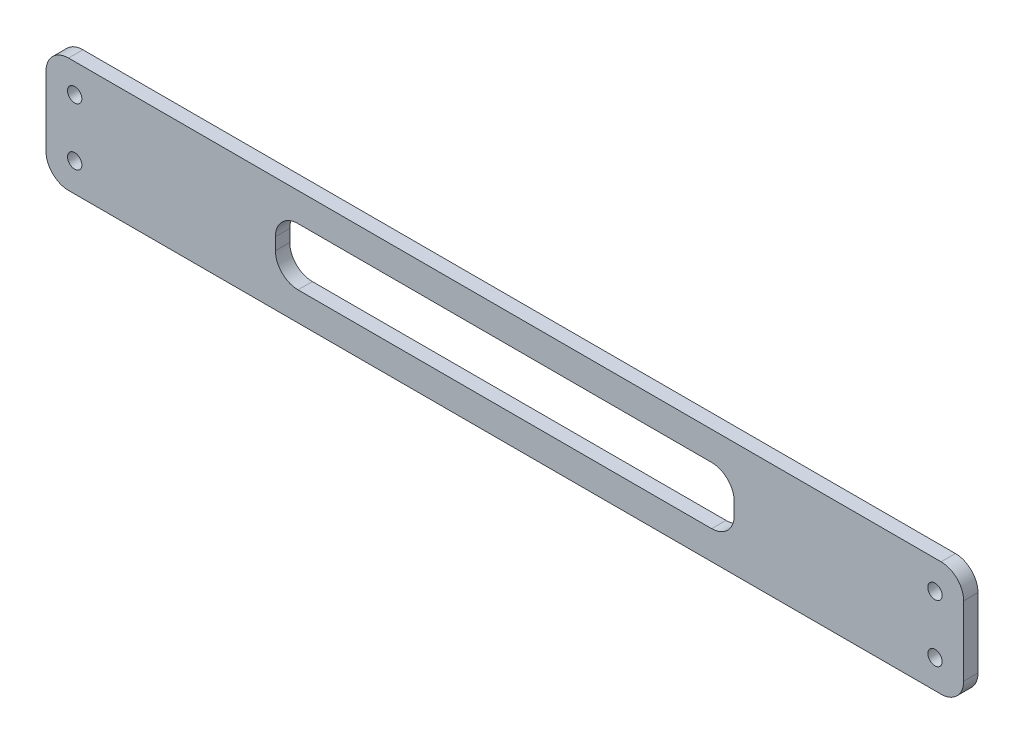
from build123d import *

# Parameters (mm, degrees)
SKETCH1_W           = 406.4
SKETCH1_H           = 50.8
BOSS_EXTRUDE1_DEPTH = 6.35
CUT_EXTRUDE1_DEPTH  = 6.35
FILLET1_R           = 10
SKETCH3_R           = 3.175
CUT_EXTRUDE2_DEPTH  = 6.35


with BuildPart() as part:
    # Sketch1 → Boss-Extrude1 (new body)
    with BuildSketch(Plane.XY):
        Rectangle(SKETCH1_W, SKETCH1_H)
    extrude(amount=BOSS_EXTRUDE1_DEPTH)

    # Sketch2 → Cut-Extrude1 (cut)
    with BuildSketch(Plane.XY.offset(6.35)):
        with BuildLine():
            Line((-91.6, -12.7), (91.6, -12.7))
            ThreePointArc((91.6, -12.7), (98.671067812, -9.771067812), (101.6, -2.7))
            Line((101.6, -2.7), (101.6, 2.7))
            ThreePointArc((101.6, 2.7), (98.671067812, 9.771067812), (91.6, 12.7))
            Line((91.6, 12.7), (-91.6, 12.7))
            ThreePointArc((-91.6, 12.7), (-98.671067812, 9.771067812), (-101.6, 2.7))
            Line((-101.6, 2.7), (-101.6, -2.7))
            ThreePointArc((-101.6, -2.7), (-98.671067812, -9.771067812), (-91.6, -12.7))
        make_face()
    extrude(amount=-CUT_EXTRUDE1_DEPTH, mode=Mode.SUBTRACT)

    # Fillet1
    fillet1_edges = [part.edges().sort_by_distance(p)[0] for p in [
        (203.2, -25.4, 3.175),
        (203.2, 25.4, 3.175),
        (-203.2, -25.4, 3.175),
        (-203.2, 25.4, 3.175),
    ]]
    fillet(fillet1_edges, radius=FILLET1_R)

    # Sketch3 → Cut-Extrude2 (cut)
    with BuildSketch(Plane.XY.offset(6.35)):
        with Locations((-190.5, 12.7)):
            Circle(SKETCH3_R)
        with Locations((-190.5, -12.7)):
            Circle(SKETCH3_R)
        with Locations((190.5, -12.7)):
            Circle(SKETCH3_R)
        with Locations((190.5, 12.7)):
            Circle(SKETCH3_R)
    extrude(amount=-CUT_EXTRUDE2_DEPTH, mode=Mode.SUBTRACT)


solid = part.part
